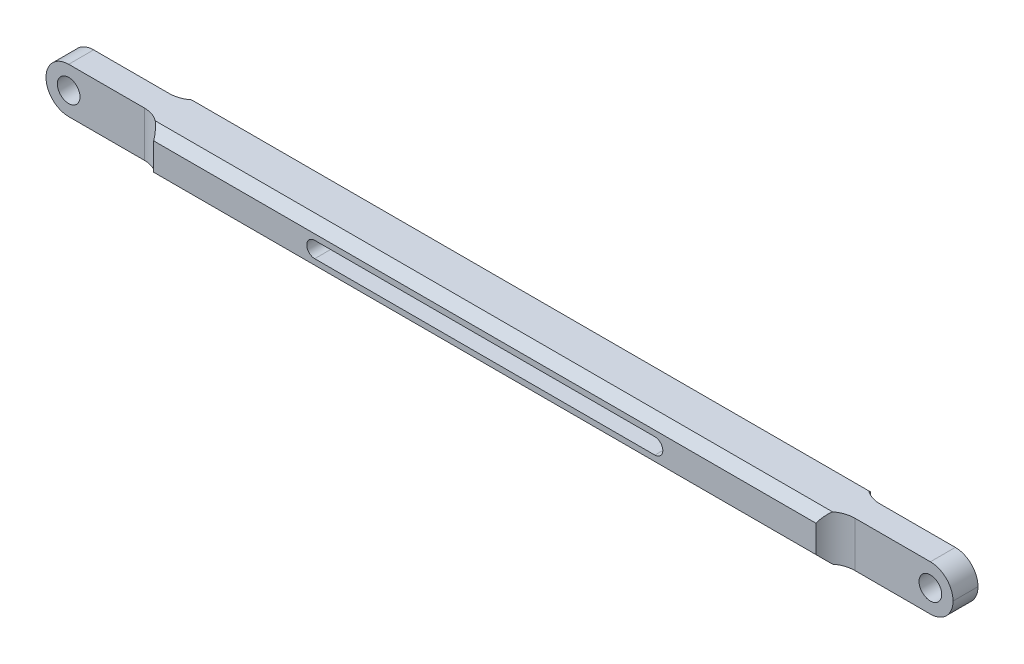
from build123d import *

# Parameters (mm, degrees)
SKETCH1_W           = 200
SKETCH1_H           = 10
BOSS_EXTRUDE1_DEPTH = 6
SKETCH2_W           = 54
SKETCH2_H           = 6.5
CUT_EXTRUDE1_DEPTH  = 15.5
FILLET1_R           = 6
FILLET2_R           = 5
CHAMFER1_SIZE       = 2
CUT_EXTRUDE2_DEPTH  = 31
SKETCH4_R           = 2.5
CUT_EXTRUDE3_DEPTH  = 31


# Some blends are built 0.0001 mm under size
with BuildPart() as part:
    # Sketch1 → Boss-Extrude1 (new, symmetric)
    with BuildSketch(Plane.XY):
        Rectangle(SKETCH1_W, SKETCH1_H)
    extrude(amount=BOSS_EXTRUDE1_DEPTH, both=True)

    # Sketch2 → Cut-Extrude1 (cut, symmetric)
    with BuildSketch(Plane(origin=(0, 0, 0), x_dir=(1, 0, 0), z_dir=(0, 1, 0))):
        with Locations((100, 6)):
            Rectangle(SKETCH2_W, SKETCH2_H)
        with Locations((100, -6)):
            Rectangle(SKETCH2_W, SKETCH2_H)
        with Locations((-100, -6)):
            Rectangle(SKETCH2_W, SKETCH2_H)
        with Locations((-100, 6)):
            Rectangle(SKETCH2_W, SKETCH2_H)
    extrude(amount=CUT_EXTRUDE1_DEPTH, both=True, mode=Mode.SUBTRACT)

    # Fillet1
    # the kernel refuses this fillet: 6 mm, written as the material it adds along each edge
    with BuildSketch(Plane(origin=(73, -5, -2.75), x_dir=(1, 0, 0), z_dir=(0, 1, 0)), Plane(origin=(-73, -5, 2.75), x_dir=(-1, 0, 0), z_dir=(0, 1, 0))) as fillet1_piece_1:
        with BuildLine():
            CenterArc((5.332682252, 6), FILLET1_R, 207.279612736, 62.720387264)
            Line((0, 3.25), (-0.106653645, 3.195))
            ThreePointArc((-0.106653645, 3.195), (-0.12, 1.625), (-0.12, 0))
            Line((-0.12, 0), (0, -0.12))
            Line((0, -0.12), (5.332682252, -0.12))
            Line((5.332682252, -0.12), (5.332682252, 0))
        make_face()
    extrude(amount=10)
    with BuildSketch(Plane(origin=(73, 5, 2.75), x_dir=(0, 0, 1), z_dir=(0, -1, 0)), Plane(origin=(-73, 5, -2.75), x_dir=(0, 0, -1), z_dir=(0, -1, 0))) as fillet1_piece_2:
        with BuildLine():
            CenterArc((6, -5.332682252), FILLET1_R, 117.279612736, 62.720387264)
            Line((0, -5.332682252), (-0.12, -5.332682252))
            Line((-0.12, -5.332682252), (-0.12, 0))
            Line((-0.12, 0), (0, 0.12))
            ThreePointArc((0, 0.12), (1.625, 0.12), (3.195, 0.106653645))
            Line((3.195, 0.106653645), (3.25, 0))
        make_face()
    extrude(amount=10)

    # Fillet2
    fillet2_edges = [part.edges().sort_by_distance(p)[0] for p in [
        (-100, -5, 0),
        (-100, 5, 0),
        (100, -5, 0),
        (100, 5, 0),
    ]]
    fillet(fillet2_edges, radius=FILLET2_R - 0.0001)  # a hair under: the kernel refuses the full size

    # Chamfer1
    chamfer1_edges = [part.edges().sort_by_distance(p)[0] for p in [
        (0, -5, -6),
        (0, 5, -6),
        (0, 5, 6),
        (0, -5, 6),
    ]]
    chamfer(chamfer1_edges, length=CHAMFER1_SIZE)

    # Sketch3 → Cut-Extrude2 (cut)
    with BuildSketch(Plane(origin=(0, 0, -6), x_dir=(-1, 0, 0), z_dir=(0, 0, -1))):
        with BuildLine():
            Line((-37.5, 1.75), (37.5, 1.75))
            ThreePointArc((37.5, 1.75), (39.25, 0), (37.5, -1.75))
            Line((37.5, -1.75), (-37.5, -1.75))
            ThreePointArc((-37.5, -1.75), (-39.25, 0), (-37.5, 1.75))
        make_face()
    extrude(amount=-CUT_EXTRUDE2_DEPTH, mode=Mode.SUBTRACT)

    # Sketch4 → Cut-Extrude3 (cut)
    with BuildSketch(Plane(origin=(0, 0, -2.75), x_dir=(-1, 0, 0), z_dir=(0, 0, -1))):
        with Locations((95, 0)):
            Circle(SKETCH4_R)
        with Locations((-95, 0)):
            Circle(SKETCH4_R)
    extrude(amount=-CUT_EXTRUDE3_DEPTH, mode=Mode.SUBTRACT)


solid = part.part
